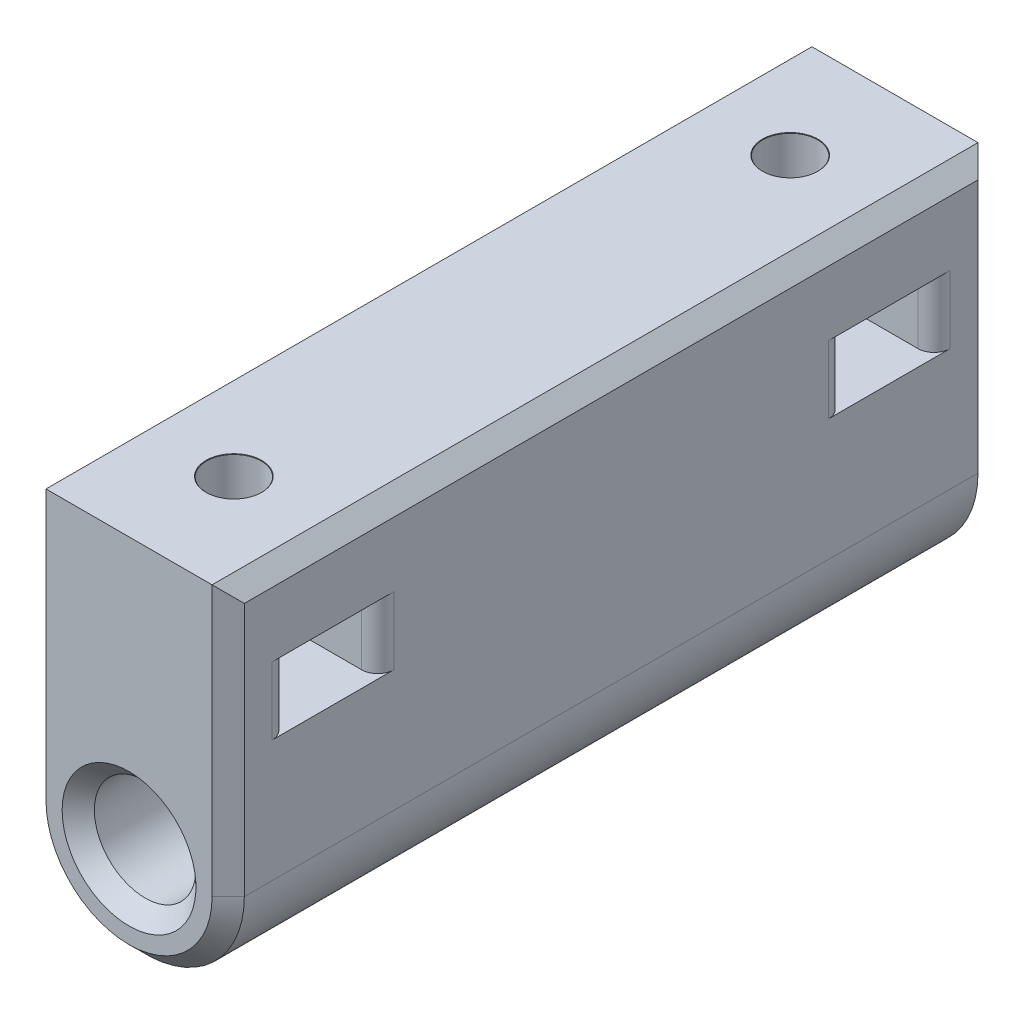
from build123d import *

# Parameters (mm, degrees)
SKETCH1_R           = 3.15
BOSS_EXTRUDE1_DEPTH = 47.5
CUT_EXTRUDE1_DEPTH  = 4.2
FILLET1_R           = 1
CHAMFER1_SIZE       = 1
CHAMFER2_SIZE       = 1


with BuildPart() as part:
    # Sketch1 → Boss-Extrude1 (new body)
    with BuildSketch(Plane.XY):
        with BuildLine():
            Line((6.15, 0), (6.15, 16.75))
            Line((6.15, 16.75), (-6.15, 16.75))
            Line((-6.15, 16.75), (-6.15, 0))
            ThreePointArc((-6.15, 0), (0, -6.15), (6.15, 0))
        make_face()
        Circle(SKETCH1_R, mode=Mode.SUBTRACT)
    extrude(amount=BOSS_EXTRUDE1_DEPTH)

    # Sketch4 → Cut-Extrude1 (cut)
    with BuildSketch(Plane(origin=(0, 11.75, 0), x_dir=(1, 0, 0), z_dir=(0, 1, 0))):
        Polygon((-3.204293994, -41), (-1.602146997, -43.775), (1.602146997, -43.775), (6.15, -43.775), (6.15, -38.225), (1.602146997, -38.225), (-1.602146997, -38.225), align=None)
    cut_extrude1 = extrude(amount=-CUT_EXTRUDE1_DEPTH, mode=Mode.SUBTRACT)

    # Sketch7 → M3 Clearance Hole1 (revolve, cut)
    with BuildSketch(Plane(origin=(0, 16.75, 41), x_dir=(0, 0, 1), z_dir=(1, 0, 0))):
        Polygon((0, 0), (0, 17.770463052), (1.7, 16.749), (1.7, 0.025), (1.725, 0), align=None)
    m3_clearance_hole1 = revolve(axis=Axis((0, 23.1, 41), (0, -1, 0)), mode=Mode.SUBTRACT)

    # Mirror1: Cut-Extrude1, M3 Clearance Hole1 across plane
    add(cut_extrude1.mirror(Plane(origin=(0, 0, 23.75), x_dir=(1, 0, 0), z_dir=(0, 0, -1))), mode=Mode.SUBTRACT)
    add(m3_clearance_hole1.mirror(Plane(origin=(0, 0, 23.75), x_dir=(1, 0, 0), z_dir=(0, 0, -1))), mode=Mode.SUBTRACT)

    # Fillet1
    fillet1_edges = [part.edges().sort_by_distance(p)[0] for p in [
        (6.15, 9.65, 9.275),
        (6.15, 9.65, 3.725),
        (6.15, 9.65, 43.775),
        (6.15, 9.65, 38.225),
    ]]
    fillet(fillet1_edges, radius=FILLET1_R)

    # Chamfer1
    chamfer1_edges = [part.edges().sort_by_distance(p)[0] for p in [
        (-6.15, 16.75, 23.75),
        (-6.15, 8.375, 0),
        (-6.15, 8.375, 47.5),
        (0, -6.15, 0),
        (0, -6.15, 47.5),
        (6.15, 8.375, 0),
        (6.15, 16.75, 23.75),
        (6.15, 8.375, 47.5),
    ]]
    chamfer(chamfer1_edges, length=CHAMFER1_SIZE)

    # Chamfer2
    chamfer2_edges = [part.edges().sort_by_distance(p)[0] for p in [
        (-3.15, 0, 0),
        (-3.15, 0, 47.5),
    ]]
    chamfer(chamfer2_edges, length=CHAMFER2_SIZE)


solid = part.part
